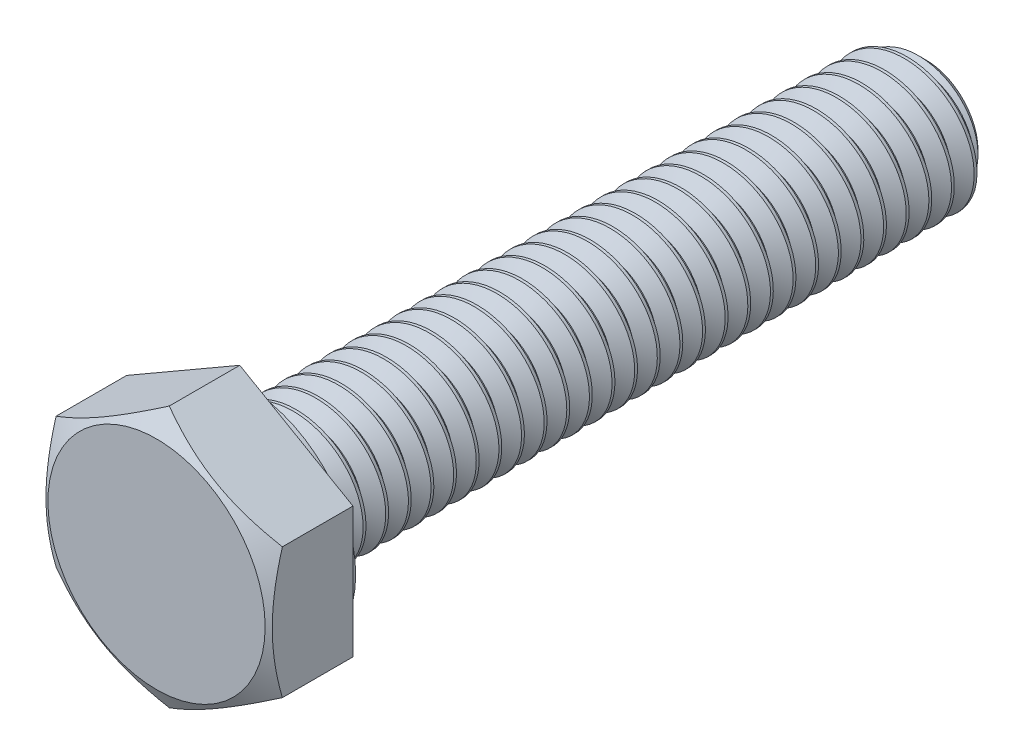
from build123d import *

# Parameters (mm, degrees)
SKETCH4_OUTSIDE_W  = 21.092
SKETCH4_OUTSIDE_H  = 21.092
CUT_EXTRUDE1_DEPTH = 35.966650779
CUT_SWEEP1_PITCH   = 1
CUT_SWEEP1_TO      = 30


with BuildPart() as part:
    # Sketch3 → Revolve1 (revolve)
    with BuildSketch(Plane(origin=(0, 0, 0), x_dir=(0, 0, -1), z_dir=(1, 0, 0)), mode=Mode.PRIVATE) as revolve1_sk:
        Polygon((-17, 0), (-17, 4.8), (-16.437947959, 5.773502692), (-13.32, 5.773502692), (-13.32, 4.8), (-13, 4.8), (-13, 3), (16.3, 3), (17, 2.3), (17, 0), align=None)
    revolve(revolve1_sk.sketch.rotate(Axis((0, 0, 17), (0, 0, -1)), 90), axis=Axis((0, 0, 17), (0, 0, -1)))

    # Sketch4 outside → Cut-Extrude1 (cut, through all)
    with BuildSketch(Plane.XY.offset(17)):
        Rectangle(SKETCH4_OUTSIDE_W, SKETCH4_OUTSIDE_H)
        Polygon((5, 2.886751346), (0, 5.773502692), (-5, 2.886751346), (-5, -2.886751346), (0, -5.773502692), (5, -2.886751346), align=None, mode=Mode.SUBTRACT)
    extrude(amount=-CUT_EXTRUDE1_DEPTH, mode=Mode.SUBTRACT)


with BuildPart() as body_2:
    # Split1: the piece on the far side of the plane
    add(part.part)
    split(bisect_by=Plane(origin=(0, 0, 13), x_dir=(-1, 0, 0), z_dir=(0, 0, -1)), keep=Keep.BOTTOM)


with BuildPart() as part_1:
    add(part.part)

    # Split1
    split(bisect_by=Plane(origin=(0, 0, 13), x_dir=(-1, 0, 0), z_dir=(0, 0, -1)), keep=Keep.TOP)

    # Cut-Sweep1: arcs per turn and ends read off the stored shape
    # Cut-Sweep1: the profile of Sketch7 screwed along a right-hand helix through 31 turns, 8 arcs to a turn; built about Z, then put on its axis
    cut_sweep1_z = Axis((0, 0, 0), (0, 0, 1))
    cut_sweep1_corners = [(2.350480947, 0, -0.375), (2.350480947, 0, -0.5), (3.054126588, 0, -0.90625), (3.054126588, 0, 0.03125)]
    with BuildLine(mode=Mode.PRIVATE) as cut_sweep1_profile:
        Line(cut_sweep1_corners[0], cut_sweep1_corners[1])
        Line(cut_sweep1_corners[1], cut_sweep1_corners[2])
        Line(cut_sweep1_corners[2], cut_sweep1_corners[3])
        Line(cut_sweep1_corners[3], cut_sweep1_corners[0])
    cut_sweep1_cap = Face(cut_sweep1_profile.wire())
    cut_sweep1_turn_angles = [0, 22.5, 45, 67.5, 90, 112.5, 135, 157.5, 180, 202.5, 225, 247.5, 270, 292.5, 315, 337.5, 360]
    cut_sweep1_turn_weights = [1, 0.9238795325112867, 1, 0.9238795325112867, 1, 0.9238795325112867, 1, 0.9238795325112867, 1, 0.9238795325112867, 1, 0.9238795325112867, 1, 0.9238795325112867, 1, 0.9238795325112867, 1]
    cut_sweep1_turn_rails = [Edge.make_bspline([Vector(p[0], p[1], 0).rotate(cut_sweep1_z, cut_sweep1_turn_angles[k]) / cut_sweep1_turn_weights[k] + Vector(0, 0, p[2] + CUT_SWEEP1_PITCH * cut_sweep1_turn_angles[k] / 360) for k in range(17)], [0, 0, 0, 1, 1, 2, 2, 3, 3, 4, 4, 5, 5, 6, 6, 7, 7, 8, 8, 8], 2, cut_sweep1_turn_weights) for p in cut_sweep1_corners]
    cut_sweep1_turn_sides = [Face.make_surface_from_curves(cut_sweep1_turn_rails[p[0]], cut_sweep1_turn_rails[p[1]]) for p in [(0, 1), (1, 2), (2, 3), (3, 0)]]
    cut_sweep1 = Plane(origin=(0, 0, -17), x_dir=(0, 1, 0), z_dir=(0, 0, 1)) * split(Solid(Shell([*[p.moved(Location((0, 0, CUT_SWEEP1_PITCH * i))) for i in range(31) for p in cut_sweep1_turn_sides], cut_sweep1_cap, cut_sweep1_cap.rotate(cut_sweep1_z, 11160).moved(Location((0, 0, CUT_SWEEP1_PITCH * 11160 / 360)))])), bisect_by=Plane.XY.offset(CUT_SWEEP1_TO), keep=Keep.BOTTOM, mode=Mode.PRIVATE)
    add(cut_sweep1, mode=Mode.SUBTRACT)

    add(body_2.part)  # Boss-Extrude2 merges body 2
    # Boss-Extrude2 cone 1 section (through the dimple's axis) → Boss-Extrude2 (revolve)
    with BuildSketch(Plane(origin=(0, 0, 13), x_dir=(0, -1, 0), z_dir=(1, 0, 0))):
        Polygon((0, 0), (3, 0), (0, 5.196152423), align=None)
    revolve(axis=Axis((0, 0, 13), (0, 0, -1)))


solid = part_1.part
